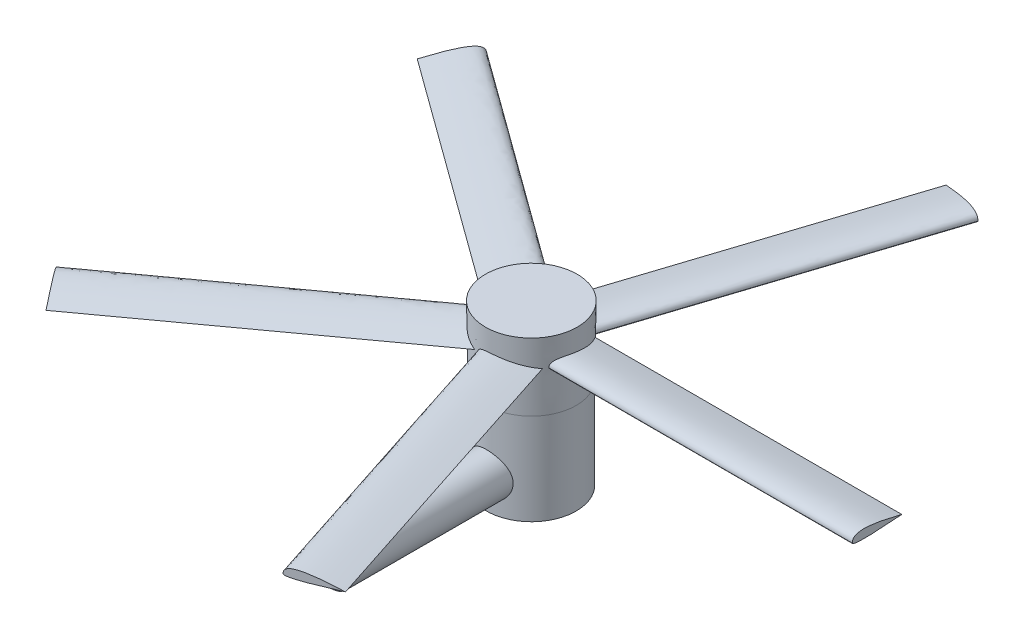
from build123d import *

# Parameters (mm, degrees)
BOSS_EXTRUDE1_DEPTH = 304.8
CIRPATTERN1_COUNT   = 5
SKETCH4_R           = 18.940035463
BOSS_EXTRUDE2_DEPTH = 177.8


with BuildPart() as part:
    # Sketch1 → Revolve1 (revolve)
    with BuildSketch(Plane.XY):
        Polygon((39.860812092, 304.8), (0, 264.939187908), (0, 223.582670835), (39.860812092, 223.582670835), align=None)
    revolve(axis=Axis((0, 223.582670835, 0), (0, 1, 0)))

    # Sketch2 → Revolve2 (revolve)
    with BuildSketch(Plane(origin=(0, 0, 0), x_dir=(0, 0, -1), z_dir=(1, 0, 0))):
        Polygon((39.860812092, 304.8), (40.752588079, 365.521147905), (0, 365.521147905), (0, 264.939187908), align=None)
    revolve(axis=Axis((0, 365.521147905, 0), (0, -1, 0)))

    # Sketch3 → Boss-Extrude1 (add)
    with BuildSketch(Plane(origin=(0, 0, 0), x_dir=(0, 0, -1), z_dir=(1, 0, 0))):
        with BuildLine():
            add(Edge.make_bspline(
                [(-19.752889725, 341.315485371), (-19.752889725, 350.862201435), (0.408567961, 347.398038579), (24.292898678, 341.315485371)],
                knots=[0, 0, 0, 0, 1, 1, 1, 1], degree=3))
            add(Edge.make_bspline(
                [(-19.752889725, 341.315485371), (-19.752889725, 337.761786872), (24.292898678, 341.315485371)],
                knots=[0, 0, 0, 1, 1, 1], degree=2))
        make_face()
    boss_extrude1 = extrude(amount=BOSS_EXTRUDE1_DEPTH)

    # CirPattern1: Boss-Extrude1 ×5 about axis
    cirpattern1_axis = Axis((0, 365.521147905, 0), (0, 1, 0))
    for i in range(1, CIRPATTERN1_COUNT):
        add(boss_extrude1.rotate(cirpattern1_axis, i * 360 / CIRPATTERN1_COUNT))

    # Sketch4 → Boss-Extrude2 (add)
    with BuildSketch(Plane.XY):
        with Locations((0, 251.915087497)):
            Circle(SKETCH4_R)
    extrude(amount=BOSS_EXTRUDE2_DEPTH)


solid = part.part
